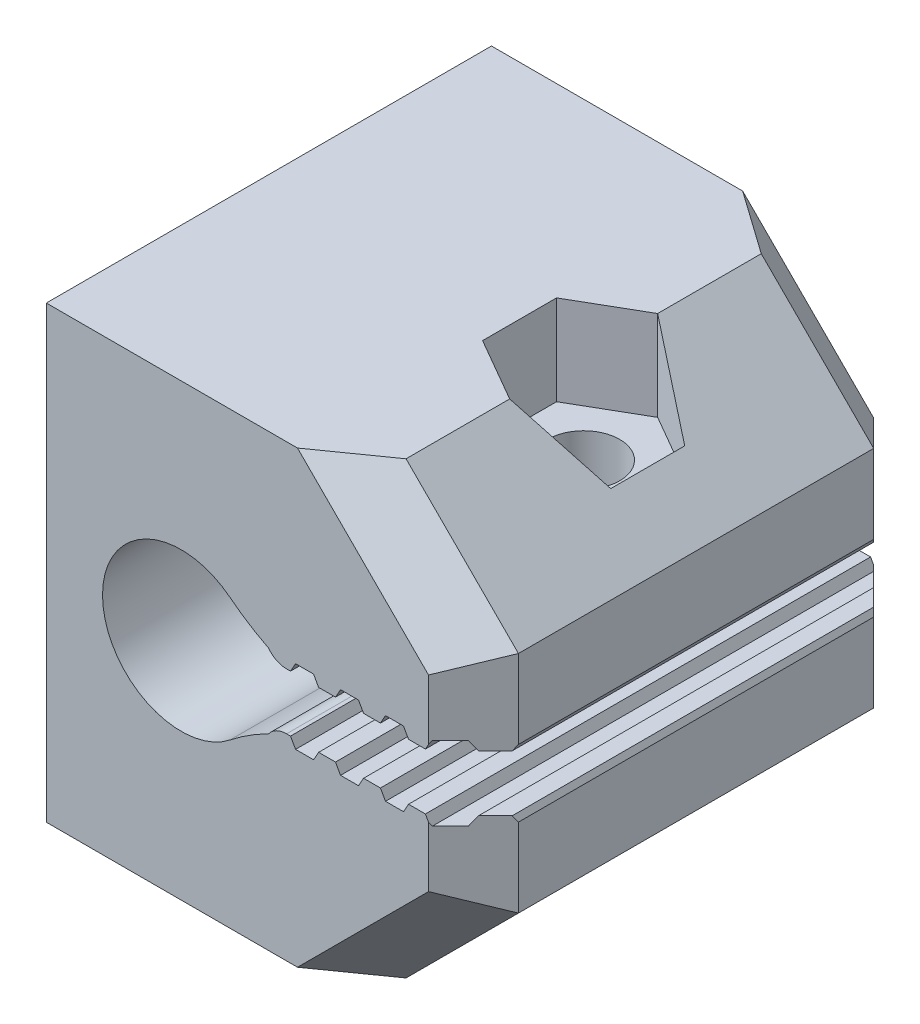
from build123d import *

# Parameters (mm, degrees)
BOSS_EXTRUDE1_DEPTH = 19.8
FILLET1_R           = 10
FILLET2_R           = 1
CHAMFER1_SIZE       = 5
CUT_EXTRUDE1_REACH  = 35.956
SKETCH2_R           = 1.6
SKETCH3_R           = 3
CUT_EXTRUDE2_DEPTH  = 4
CUT_EXTRUDE3_DEPTH  = 4
CHAMFER2_SIZE       = 2


with BuildPart() as part:
    # Sketch1 → Boss-Extrude1 (new body)
    with BuildSketch(Plane.XY):
        with BuildLine():
            Line((18.861664867, 11.25), (18.111664867, 11.25))
            Line((18.111664867, 11.25), (17.886664867, 11.65))
            Line((17.886664867, 11.65), (17.086664867, 11.65))
            Line((17.086664867, 11.65), (16.861664867, 11.25))
            Line((16.861664867, 11.25), (16.111664867, 11.25))
            Line((16.111664867, 11.25), (15.886664867, 11.65))
            Line((15.886664867, 11.65), (15.086664867, 11.65))
            Line((15.086664867, 11.65), (14.861664867, 11.25))
            Line((14.861664867, 11.25), (14.111664867, 11.25))
            Line((14.111664867, 11.25), (13.886664867, 11.65))
            Line((13.886664867, 11.65), (13.086664867, 11.65))
            Line((13.086664867, 11.65), (12.861664867, 11.25))
            Line((12.861664867, 11.25), (12.111664867, 11.25))
            Line((12.111664867, 11.25), (11.886664867, 11.65))
            Line((11.886664867, 11.65), (11.086664867, 11.65))
            Line((11.086664867, 11.65), (10.861664867, 11.25))
            Line((10.861664867, 11.25), (10.111664867, 11.25))
            Line((10.111664867, 11.25), (9.886664867, 11.65))
            Line((9.886664867, 11.65), (9.086664867, 11.65))
            ThreePointArc((9.086664867, 11.65), (2.5, 10), (9.086664867, 8.35))
            Line((9.086664867, 8.35), (9.886664867, 8.35))
            Line((9.886664867, 8.35), (10.111664867, 8.75))
            Line((10.111664867, 8.75), (10.861664867, 8.75))
            Line((10.861664867, 8.75), (11.086664867, 8.35))
            Line((11.086664867, 8.35), (11.886664867, 8.35))
            Line((11.886664867, 8.35), (12.111664867, 8.75))
            Line((12.111664867, 8.75), (12.861664867, 8.75))
            Line((12.861664867, 8.75), (13.086664867, 8.35))
            Line((13.086664867, 8.35), (13.886664867, 8.35))
            Line((13.886664867, 8.35), (14.111664867, 8.75))
            Line((14.111664867, 8.75), (14.861664867, 8.75))
            Line((14.861664867, 8.75), (15.086664867, 8.35))
            Line((15.086664867, 8.35), (15.886664867, 8.35))
            Line((15.886664867, 8.35), (16.111664867, 8.75))
            Line((16.111664867, 8.75), (16.861664867, 8.75))
            Line((16.861664867, 8.75), (17.086664867, 8.35))
            Line((17.086664867, 8.35), (17.886664867, 8.35))
            Line((17.886664867, 8.35), (18.111664867, 8.75))
            Line((18.111664867, 8.75), (18.861664867, 8.75))
            Line((18.861664867, 8.75), (19, 8.504070874))
            Line((19, 8.504070874), (19, 0))
            Line((19, 0), (0, 0))
            Line((0, 0), (0, 20))
            Line((0, 20), (19, 20))
            Line((19, 20), (19, 11.495929126))
            Line((19, 11.495929126), (18.861664867, 11.25))
        make_face()
    extrude(amount=BOSS_EXTRUDE1_DEPTH)

    # Fillet1
    # the kernel refuses this fillet: 10 mm, written as the material it takes off along each edge
    with BuildSketch(Plane(origin=(9.086664867, 8.35, -3.562523753), x_dir=(1, 0, 0), z_dir=(0, 0, 1))) as fillet1_piece_1:
        with BuildLine():
            CenterArc((5.295321975, -8.932641286), FILLET1_R, 116.713674189, 11.667329514)
            Line((-0.913557167, -1.093647741), (-1.03773475, -0.93686787))
            ThreePointArc((-1.03773475, -0.93686787), (-0.554023827, -0.465591965), (-0.17638085, 0.094285714))
            Line((-0.17638085, 0.094285714), (0, 0.2))
            ThreePointArc((0, 0.2), (0.4, 0.2), (0.710093561, 0.178652826))
            Line((0.710093561, 0.178652826), (0.8, 0))
        make_face()
    extrude(amount=26.925047506, mode=Mode.SUBTRACT)
    with BuildSketch(Plane(origin=(9.086664867, 11.65, -3.562523753), x_dir=(1, 0, 0), z_dir=(0, 0, 1))) as fillet1_piece_2:
        with BuildLine():
            CenterArc((5.295321975, 8.932641286), FILLET1_R, 231.618996297, 11.667329514)
            Line((-0.913557167, 1.093647741), (-1.03773475, 0.93686787))
            ThreePointArc((-1.03773475, 0.93686787), (-0.554023827, 0.465591965), (-0.17638085, -0.094285714))
            Line((-0.17638085, -0.094285714), (0, -0.2))
            ThreePointArc((0, -0.2), (0.4, -0.2), (0.710093561, -0.178652826))
            Line((0.710093561, -0.178652826), (0.8, 0))
        make_face()
    extrude(amount=26.925047506, mode=Mode.SUBTRACT)

    # Fillet2
    # the kernel refuses this fillet: 1 mm, written as the material it takes off along each edge
    with BuildSketch(Plane(origin=(10.111664867, 8.75, -1.4375), x_dir=(-0.4902612396325597, -0.8715755371245488, 0), z_dir=(0, 0, 1))) as fillet2_piece_1:
        with BuildLine():
            CenterArc((0.589675324, 0.991417173), FILLET2_R, 209.357753543, 53.130102354)
            Line((-0.281900213, 0.501155934), (-0.299331724, 0.491350709))
            Line((-0.299331724, 0.491350709), (-0.017431511, -0.009805225))
            Line((-0.017431511, -0.009805225), (0, -0.02))
            ThreePointArc((0, -0.02), (0.229469497, -0.02), (0.456324267, -0.019828343))
            Line((0.456324267, -0.019828343), (0.458938994, 0))
        make_face()
    extrude(amount=22.675, mode=Mode.SUBTRACT)
    with BuildSketch(Plane(origin=(10.111664867, 11.25, -1.4375), x_dir=(-0.4902612396325682, 0.8715755371245442, 0), z_dir=(0, 0, 1))) as fillet2_piece_2:
        with BuildLine():
            CenterArc((0.589675324, -0.991417173), FILLET2_R, 97.512144103, 53.130102354)
            Line((-0.281900213, -0.501155934), (-0.299331724, -0.491350709))
            Line((-0.299331724, -0.491350709), (-0.017431511, 0.009805225))
            Line((-0.017431511, 0.009805225), (0, 0.02))
            ThreePointArc((0, 0.02), (0.229469497, 0.02), (0.456324267, 0.019828343))
            Line((0.456324267, 0.019828343), (0.458938994, 0))
        make_face()
    extrude(amount=22.675, mode=Mode.SUBTRACT)

    # Chamfer1
    chamfer1_edges = [part.edges().sort_by_distance(p)[0] for p in [
        (19, 20, 9.9),
        (19, 0, 9.9),
    ]]
    chamfer(chamfer1_edges, length=CHAMFER1_SIZE)

    # Cut-Extrude1: up to this face of the body (flat: up to its plane)
    cut_extrude1_end = Plane(part.part.faces().sort_by_distance((7, 20, 9.9))[0])
    # Sketch2 → Cut-Extrude1 (cut, up to the picked face)
    with BuildSketch(Plane.XZ, mode=Mode.PRIVATE) as cut_extrude1_sk1:
        with Locations(Location((14, 9.9, 0), (0, 0, 270))):
            Circle(SKETCH2_R)
    cut_extrude1_tool1 = split(extrude(cut_extrude1_sk1.sketch, amount=-CUT_EXTRUDE1_REACH, mode=Mode.PRIVATE), bisect_by=cut_extrude1_end, keep=Keep.BOTH, mode=Mode.PRIVATE)
    add(cut_extrude1_tool1.solids().sort_by(Axis((14, 0, 9.9), (0, 1, 0)))[0], mode=Mode.SUBTRACT)

    # Sketch3 → Cut-Extrude2 (cut)
    with BuildSketch(Plane.XZ):
        with Locations(Location((14, 9.9, 0), (0, 0, 270))):
            Circle(SKETCH3_R)
    extrude(amount=-CUT_EXTRUDE2_DEPTH, mode=Mode.SUBTRACT)

    # Sketch4 → Cut-Extrude3 (cut)
    with BuildSketch(Plane(origin=(0, 20, 0), x_dir=(1, 0, 0), z_dir=(0, 1, 0))):
        Polygon((11.15, -8.254551733), (11.15, -11.545448267), (14, -13.190896534), (16.85, -11.545448267), (16.85, -8.254551733), (14, -6.609103466), align=None)
    extrude(amount=-CUT_EXTRUDE3_DEPTH, mode=Mode.SUBTRACT)

    # Chamfer2
    chamfer2_edges = [part.edges().sort_by_distance(p)[0] for p in [
        (16.5, 2.5, 0),
        (19, 6.752035437, 0),
        (16.5, 17.5, 0),
        (19, 13.247964563, 0),
        (16.5, 17.5, 19.8),
        (19, 13.247964563, 19.8),
        (19, 6.752035437, 19.8),
        (16.5, 2.5, 19.8),
    ]]
    chamfer(chamfer2_edges, length=CHAMFER2_SIZE)


solid = part.part
